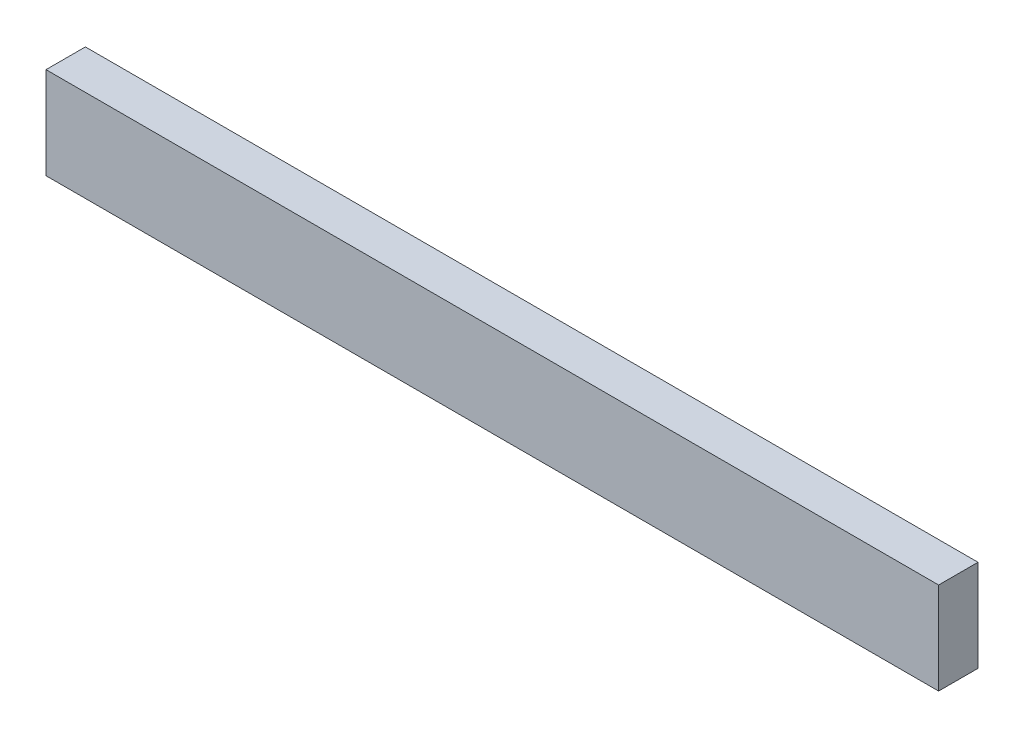
from build123d import *

# Parameters (mm, degrees)
BOSS_EXTRUDE1_DEPTH      = 431.8
BOSS_EXTRUDE1_DEPTH_BACK = 431.8
SKETCH3_W                = 38.1
SKETCH3_H                = 88.9


with BuildPart() as part:
    # Sketch3 → Boss-Extrude1 (new, two sides: drawn at the far end of the back side and taken through both)
    with BuildSketch(Plane(origin=(0, 0, 0), x_dir=(0, 0, -1), z_dir=(1, 0, 0)).offset(-BOSS_EXTRUDE1_DEPTH_BACK)):
        Rectangle(SKETCH3_W, SKETCH3_H)
    extrude(amount=BOSS_EXTRUDE1_DEPTH + BOSS_EXTRUDE1_DEPTH_BACK)


solid = part.part
